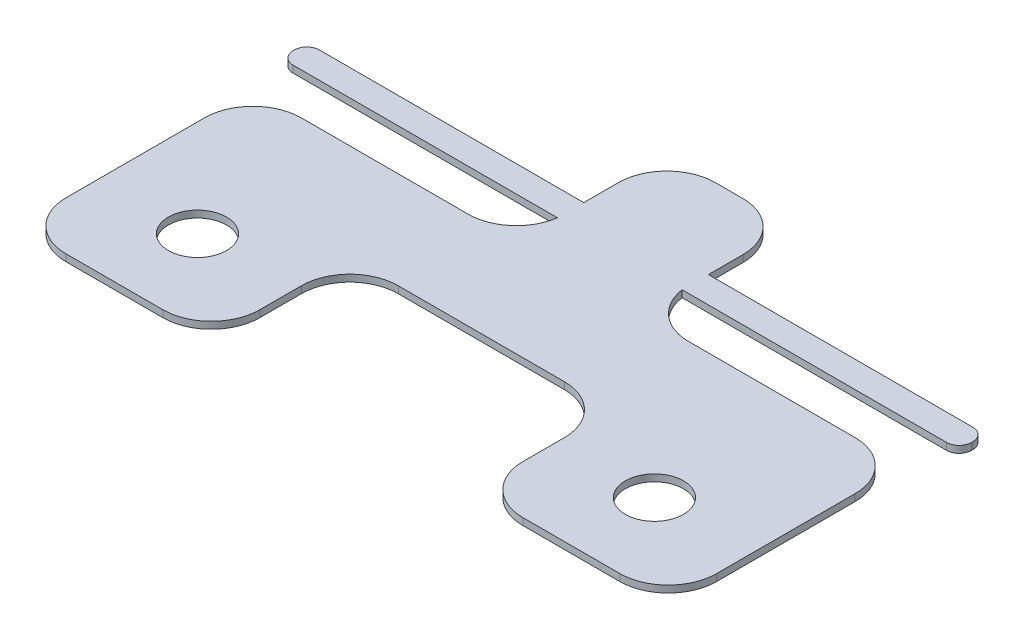
from build123d import *

# Parameters (mm, degrees)
SKETCH2_R          = 2.1
BASE_FLANGE1_DEPTH = 0.5
FILLET1_R          = 3.5
FILLET2_R          = 0.9


# Sheet-metal steps are written as plain solids
with BuildPart() as part:
    # Base-Flange1: sheet metal written as solids
    # Sketch2 → Base-Flange1 (new body)
    with BuildSketch(Plane(origin=(0, 0, 0), x_dir=(1, 0, 0), z_dir=(0, 1, 0))):
        Polygon((-9.5, 0), (9.5, 0), (9.5, -10), (23.5, -10), (23.5, 7), (4.5, 7), (4.5, 10), (24.5, 10), (24.5, 11.9), (4.5, 11.9), (4.5, 17.9), (-4.5, 17.9), (-4.5, 11.9), (-24.5, 11.9), (-24.5, 10), (-4.5, 10), (-4.5, 7), (-23.5, 7), (-23.5, -10), (-9.5, -10), align=None)
        with Locations(Location((16.5, -4, 0), (0, 0, 270))):
            Circle(SKETCH2_R, mode=Mode.SUBTRACT)
        with Locations(Location((-16.5, -4, 0), (0, 0, 90))):
            Circle(SKETCH2_R, mode=Mode.SUBTRACT)
    extrude(amount=-BASE_FLANGE1_DEPTH)

    # Fillet1
    # the kernel refuses this fillet: 3.5 mm, written as the material it adds along each edge
    with BuildSketch(Plane(origin=(9.5, 0, 0), x_dir=(-1, 0, 0), z_dir=(0, -1, 0))) as fillet1_piece_1:
        with BuildLine():
            CenterArc((FILLET1_R, -FILLET1_R), FILLET1_R, 90, 90)
            Line((0, -FILLET1_R), (0, 0))
            Line((0, 0), (FILLET1_R, 0))
        make_face()
    extrude(amount=0.5)
    with BuildSketch(Plane(origin=(-9.5, 0, 0), x_dir=(1, 0, 0), z_dir=(0, -1, 0))) as fillet1_piece_2:
        with BuildLine():
            CenterArc((FILLET1_R, FILLET1_R), FILLET1_R, 180, 90)
            Line((0, FILLET1_R), (0, 0))
            Line((0, 0), (FILLET1_R, 0))
        make_face()
    extrude(amount=0.5)
    with BuildSketch(Plane(origin=(-4.5, 0, -7), x_dir=(0, 0, -1), z_dir=(0, -1, 0))) as fillet1_piece_3:
        with BuildLine():
            CenterArc((3.5, -3.464101615), FILLET1_R, 98.213210702, 81.786789298)
            Line((0, -3.464101615), (0, 0))
            Line((0, 0), (3, 0))
        make_face()
    extrude(amount=0.5)
    with BuildSketch(Plane(origin=(4.5, 0, -7), x_dir=(1, 0, 0), z_dir=(0, -1, 0))) as fillet1_piece_4:
        with BuildLine():
            CenterArc((3.464101615, -3.5), FILLET1_R, 90, 81.786789298)
            Line((0, -3), (0, 0))
            Line((0, 0), (3.464101615, 0))
        make_face()
    extrude(amount=0.5)
    # the kernel refuses this fillet: 3.5 mm, written as the material it takes off along each edge
    with BuildSketch(Plane(origin=(-9.5, 8.75, 10), x_dir=(-1, 0, 0), z_dir=(0, -1, 0)), Plane(origin=(-23.5, 8.75, 10), x_dir=(0, 0, -1), z_dir=(0, -1, 0)), Plane(origin=(-23.5, 8.75, -7), x_dir=(1, 0, 0), z_dir=(0, -1, 0)), Plane(origin=(-4.5, 8.75, -17.9), x_dir=(1, 0, 0), z_dir=(0, -1, 0)), Plane(origin=(4.5, 8.75, -17.9), x_dir=(0, 0, 1), z_dir=(0, -1, 0)), Plane(origin=(23.5, 8.75, -7), x_dir=(0, 0, 1), z_dir=(0, -1, 0)), Plane(origin=(23.5, 8.75, 10), x_dir=(-1, 0, 0), z_dir=(0, -1, 0)), Plane(origin=(9.5, 8.75, 10), x_dir=(0, 0, -1), z_dir=(0, -1, 0))) as fillet1_2_piece_1:
        with BuildLine():
            CenterArc((FILLET1_R, FILLET1_R), FILLET1_R, 180, 90)
            Line((0, FILLET1_R), (0, 0))
            Line((0, 0), (FILLET1_R, 0))
        make_face()
    extrude(amount=18, mode=Mode.SUBTRACT)

    # Fillet2
    fillet2_edges = [part.edges().sort_by_distance(p)[0] for p in [
        (-24.5, -0.25, -10),
        (-24.5, -0.25, -11.9),
        (24.5, -0.25, -11.9),
        (24.5, -0.25, -10),
    ]]
    fillet(fillet2_edges, radius=FILLET2_R)


solid = part.part
